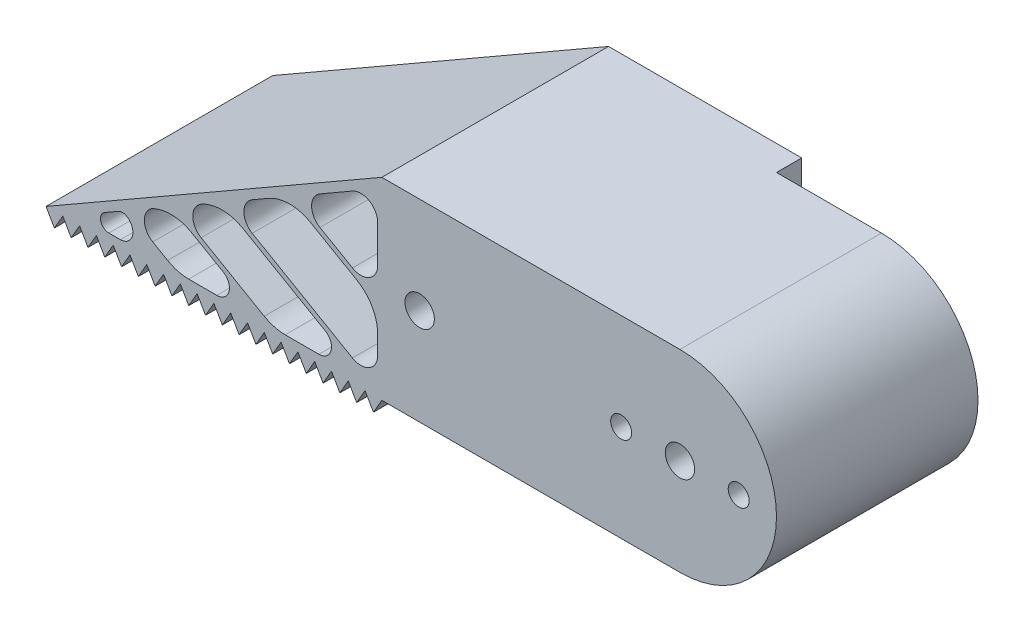
from build123d import *

# Parameters (mm, degrees)
BOSS_EXTRUDE1_DEPTH = 30
SKETCH4_W           = 47
SKETCH4_H           = 3
CUT_EXTRUDE1_DEPTH  = 30
CUT_EXTRUDE2_DEPTH  = 3
SKETCH6_R           = 11.5
CUT_EXTRUDE3_DEPTH  = 3
CUT_EXTRUDE4_DEPTH  = 3
SKETCH8_R           = 1.75
CUT_EXTRUDE5_DEPTH  = 63
SKETCH9_R           = 1.25
CUT_EXTRUDE6_DEPTH  = 63
SKETCH11_R          = 1.75
CUT_EXTRUDE7_DEPTH  = 63
CUT_EXTRUDE8_START  = -30
CUT_EXTRUDE8_DEPTH  = 30
CUT_EXTRUDE12_DEPTH = 3
SKETCH26_W          = 13.519432365
SKETCH26_H          = 72.724713812
CUT_EXTRUDE18_DEPTH = 3
SKETCH21_W          = 40
SKETCH21_H          = 3
CUT_EXTRUDE16_DEPTH = 27
SKETCH19_W          = 40
SKETCH19_H          = 3
CUT_EXTRUDE15_DEPTH = 77
SKETCH27_W          = 110.290259741
SKETCH27_H          = 28.330573593
CUT_EXTRUDE19_DEPTH = 98.765024421


# Read off the part's stored shape, not the designer's step: Cut-Extrude8
with BuildPart() as part:
    # Sketch2 → Boss-Extrude1 (new body)
    with BuildSketch(Plane.XY):
        Polygon((2, 0), (0, 0), (1, -1.732050808), align=None)
        Polygon((4, 0), (2, 0), (3, -1.732050808), align=None)
        Polygon((6, 0), (4, 0), (5, -1.732050808), align=None)
        Polygon((8, 0), (6, 0), (7, -1.732050808), align=None)
        Polygon((10, 0), (8, 0), (9, -1.732050808), align=None)
        Polygon((12, 0), (10, 0), (11, -1.732050808), align=None)
        Polygon((14, 0), (12, 0), (13, -1.732050808), align=None)
        Polygon((16, 0), (14, 0), (15, -1.732050808), align=None)
        Polygon((18, 0), (16, 0), (17, -1.732050808), align=None)
        Polygon((20, 0), (18, 0), (19, -1.732050808), align=None)
        Polygon((22, 0), (20, 0), (21, -1.732050808), align=None)
        Polygon((24, 0), (22, 0), (23, -1.732050808), align=None)
        Polygon((25, -1.732050808), (26, 0), (24, 0), align=None)
        Polygon((27, -1.732050808), (28, 0), (26, 0), align=None)
        Polygon((29, -1.732050808), (30, 0), (28, 0), align=None)
        Polygon((31, -1.732050808), (32, 0), (30, 0), align=None)
        Polygon((33, -1.732050808), (34, 0), (32, 0), align=None)
        Polygon((35, -1.732050808), (36, 0), (34, 0), align=None)
        Polygon((37, -1.732050808), (38, 0), (36, 0), align=None)
        Polygon((39, -1.732050808), (40, 0), (38, 0), align=None)
        Polygon((75.5, 23), (75.5, 0), (0, 0), (40, 23), align=None)
        with BuildLine():
            ThreePointArc((75.5, 0), (87, 11.5), (75.5, 23))
            Line((75.5, 23), (75.5, 0))
        make_face()
    extrude(amount=BOSS_EXTRUDE1_DEPTH)

    # Sketch4 → Cut-Extrude1 (cut)
    with BuildSketch(Plane.XZ):
        with Locations((63.5, 1.5)):
            Rectangle(SKETCH4_W, SKETCH4_H)
    extrude(amount=-CUT_EXTRUDE1_DEPTH, mode=Mode.SUBTRACT)

    # Sketch5 → Cut-Extrude2 (cut)
    with BuildSketch(Plane(origin=(0, 0, 3), x_dir=(-1, 0, 0), z_dir=(0, 0, -1))):
        with BuildLine():
            Line((-44.5, 15.5), (-100.316269326, 15.5))
            Line((-100.316269326, 15.5), (-100.316269326, 7.5))
            Line((-100.316269326, 7.5), (-44.5, 7.5))
            ThreePointArc((-44.5, 7.5), (-40.5, 11.5), (-44.5, 15.5))
        make_face()
    extrude(amount=-CUT_EXTRUDE2_DEPTH, mode=Mode.SUBTRACT)

    # Sketch6 → Cut-Extrude3 (cut)
    with BuildSketch(Plane(origin=(0, 0, 3), x_dir=(-1, 0, 0), z_dir=(0, 0, -1))):
        with Locations((-75.5, 11.5)):
            Circle(SKETCH6_R)
    extrude(amount=-CUT_EXTRUDE3_DEPTH, mode=Mode.SUBTRACT)

    # Sketch7 → Cut-Extrude4 (cut)
    with BuildSketch(Plane(origin=(0, 0, 3), x_dir=(-1, 0, 0), z_dir=(0, 0, -1))):
        with BuildLine():
            Line((-64.718070674, 7.5), (-64.718070674, 0))
            Line((-64.718070674, 0), (-75.5, 0))
            ThreePointArc((-75.5, 0), (-68.933037232, 2.059396206), (-64.718070674, 7.5))
        make_face()
    extrude(amount=-CUT_EXTRUDE4_DEPTH, mode=Mode.SUBTRACT)

    # Sketch8 → Cut-Extrude5 (cut)
    with BuildSketch(Plane(origin=(0, 0, 6), x_dir=(-1, 0, 0), z_dir=(0, 0, -1))):
        with Locations((-75.5, 11.5)):
            Circle(SKETCH8_R)
    extrude(amount=-CUT_EXTRUDE5_DEPTH, mode=Mode.SUBTRACT)

    # Sketch9 → Cut-Extrude6 (cut)
    with BuildSketch(Plane(origin=(0, 0, 6), x_dir=(-1, 0, 0), z_dir=(0, 0, -1))):
        with Locations((-68.5, 11.5)):
            Circle(SKETCH9_R)
        with Locations((-82.5, 11.5)):
            Circle(SKETCH9_R)
    extrude(amount=-CUT_EXTRUDE6_DEPTH, mode=Mode.SUBTRACT)

    # Sketch11 → Cut-Extrude7 (cut)
    with BuildSketch(Plane(origin=(0, 0, 6), x_dir=(-1, 0, 0), z_dir=(0, 0, -1))):
        with Locations((-44.5, 11.5)):
            Circle(SKETCH11_R)
    extrude(amount=-CUT_EXTRUDE7_DEPTH, mode=Mode.SUBTRACT)

    # Cut-Extrude8 outline → Cut-Extrude8 (cut)
    with BuildSketch(Plane(origin=(0, 0, 0), x_dir=(-1, 0, 0), z_dir=(0, 0, -1)).offset(CUT_EXTRUDE8_START)):
        with BuildLine():
            ThreePointArc((-32.629244175, 14.144182994), (-31.629244953, 15.877998297), (-32.632301926, 17.610046408))
            Line((-32.632301926, 17.610046408), (-36.503057751, 19.835731008))
            ThreePointArc((-36.503057751, 19.835731008), (-38.501527709, 19.833086287), (-39.5, 18.101918401))
            Line((-39.5, 18.101918401), (-39.5, 13.641451884))
            ThreePointArc((-39.5, 13.641451884), (-38.5, 11.909401077), (-36.5, 11.909401077))
            Line((-36.5, 11.909401077), (-32.629244175, 14.144182994))
        make_face()
        with BuildLine():
            ThreePointArc((-7.49052939, 1), (-6.524375597, 1.742033241), (-6.992058265, 2.866906303))
            Line((-6.992058265, 2.866906303), (-8.609059399, 3.796681955))
            ThreePointArc((-8.609059399, 3.796681955), (-9.106957749, 3.929775488), (-9.605008237, 3.797252409))
            ThreePointArc((-9.605008237, 3.797252409), (-10.300350282, 2.110050397), (-8.851923789, 1))
            Line((-8.851923789, 1), (-7.49052939, 1))
        make_face()
        with BuildLine():
            ThreePointArc((-24.565011822, 9.507249391), (-23.5650126, 11.241064694), (-24.568069573, 12.973112805))
            Line((-24.568069573, 12.973112805), (-26.524452009, 14.098032706))
            ThreePointArc((-26.524452009, 14.098032706), (-29.021218869, 14.763499245), (-31.516807631, 14.09362821))
            Line((-31.516807631, 14.09362821), (-37, 10.927905619))
            ThreePointArc((-37, 10.927905619), (-38.830127019, 9.0977786), (-39.5, 6.5977786))
            Line((-39.5, 6.5977786), (-39.5, 4.348631561))
            ThreePointArc((-39.5, 4.348631561), (-38.5, 2.616580754), (-36.5, 2.616580754))
            Line((-36.5, 2.616580754), (-24.565011822, 9.507249391))
        make_face()
        with BuildLine():
            ThreePointArc((-21.101923789, 3.799038106), (-21.800812528, 2.111771433), (-20.351923789, 1))
            Line((-20.351923789, 1), (-16.989745962, 1))
            ThreePointArc((-16.989745962, 1), (-15.695650737, 1.170370869), (-14.489745962, 1.669872981))
            Line((-14.489745962, 1.669872981), (-12.715894213, 2.694006766))
            ThreePointArc((-12.715894213, 2.694006766), (-11.717324154, 4.350441969), (-12.587876643, 6.077595149))
            ThreePointArc((-12.587876643, 6.077595149), (-14.991941557, 6.624711226), (-17.365185047, 5.956445224))
            Line((-17.365185047, 5.956445224), (-21.101923789, 3.799038106))
        make_face()
        with BuildLine():
            ThreePointArc((-33.251923789, 3.799038106), (-33.950812528, 2.111771433), (-32.501923789, 1))
            Line((-32.501923789, 1), (-28.489745962, 1))
            ThreePointArc((-28.489745962, 1), (-27.195650737, 1.170370869), (-25.989745962, 1.669872981))
            Line((-25.989745962, 1.669872981), (-18.477621591, 6.007000009))
            ThreePointArc((-18.477621591, 6.007000009), (-17.477623561, 7.73624352), (-18.472763157, 9.468287505))
            ThreePointArc((-18.472763157, 9.468287505), (-20.964215142, 10.126554039), (-23.452575278, 9.456694606))
            Line((-23.452575278, 9.456694606), (-33.251923789, 3.799038106))
        make_face()
    extrude(amount=CUT_EXTRUDE8_DEPTH, mode=Mode.SUBTRACT)

    # Sketch15 → Cut-Extrude12 (cut)
    with BuildSketch(Plane(origin=(0, 0, 3), x_dir=(-1, 0, 0), z_dir=(0, 0, -1))):
        with BuildLine():
            Line((-75.5, 23), (-70.601020514, 23))
            ThreePointArc((-70.601020514, 23), (-66.32756197, 19.992136397), (-63.657280718, 15.5))
            Line((-63.657280718, 15.5), (-64.718070674, 15.5))
            ThreePointArc((-64.718070674, 15.5), (-68.933037232, 20.940603794), (-75.5, 23))
        make_face()
    extrude(amount=-CUT_EXTRUDE12_DEPTH, mode=Mode.SUBTRACT)


with BuildPart() as body_2:
    # Mirror6: mirrored copy
    add(part.part.mirror(Plane(origin=(0, -5, 0), x_dir=(0, 0, 1), z_dir=(0, -1, 0))))


with BuildPart() as cut_extrude18_tool:
    # Sketch26 → Cut-Extrude18 (new body)
    with BuildSketch(Plane(origin=(0, 0, 3), x_dir=(-1, 0, 0), z_dir=(0, 0, -1))):
        with Locations((-69.759716183, -4.516968795)):
            Rectangle(SKETCH26_W, SKETCH26_H)
    extrude(amount=-CUT_EXTRUDE18_DEPTH)


with BuildPart() as part_1:
    add(part.part)

    # Cut-Extrude18: cut by cut_extrude18_tool
    add(cut_extrude18_tool.part, mode=Mode.SUBTRACT)

    # Sketch21 → Cut-Extrude16 (cut)
    with BuildSketch(Plane(origin=(0, 23, 0), x_dir=(1, 0, 0), z_dir=(0, 1, 0))):
        with Locations((20, -1.5)):
            Rectangle(SKETCH21_W, SKETCH21_H)
    extrude(amount=-CUT_EXTRUDE16_DEPTH, mode=Mode.SUBTRACT)


with BuildPart() as body_2_1:
    add(body_2.part)

    # Cut-Extrude18: cut by cut_extrude18_tool
    add(cut_extrude18_tool.part, mode=Mode.SUBTRACT)

    # Sketch19 → Cut-Extrude15 (cut)
    with BuildSketch(Plane.XZ.offset(33)):
        with Locations((20, 1.5)):
            Rectangle(SKETCH19_W, SKETCH19_H)
    extrude(amount=-CUT_EXTRUDE15_DEPTH, mode=Mode.SUBTRACT)

    # Sketch27 → Cut-Extrude19 (cut, through all)
    with BuildSketch(Plane.XY):
        with Locations((42.931493507, -21.344561689)):
            Rectangle(SKETCH27_W, SKETCH27_H)
    extrude(amount=CUT_EXTRUDE19_DEPTH, mode=Mode.SUBTRACT)


solid = part_1.part
